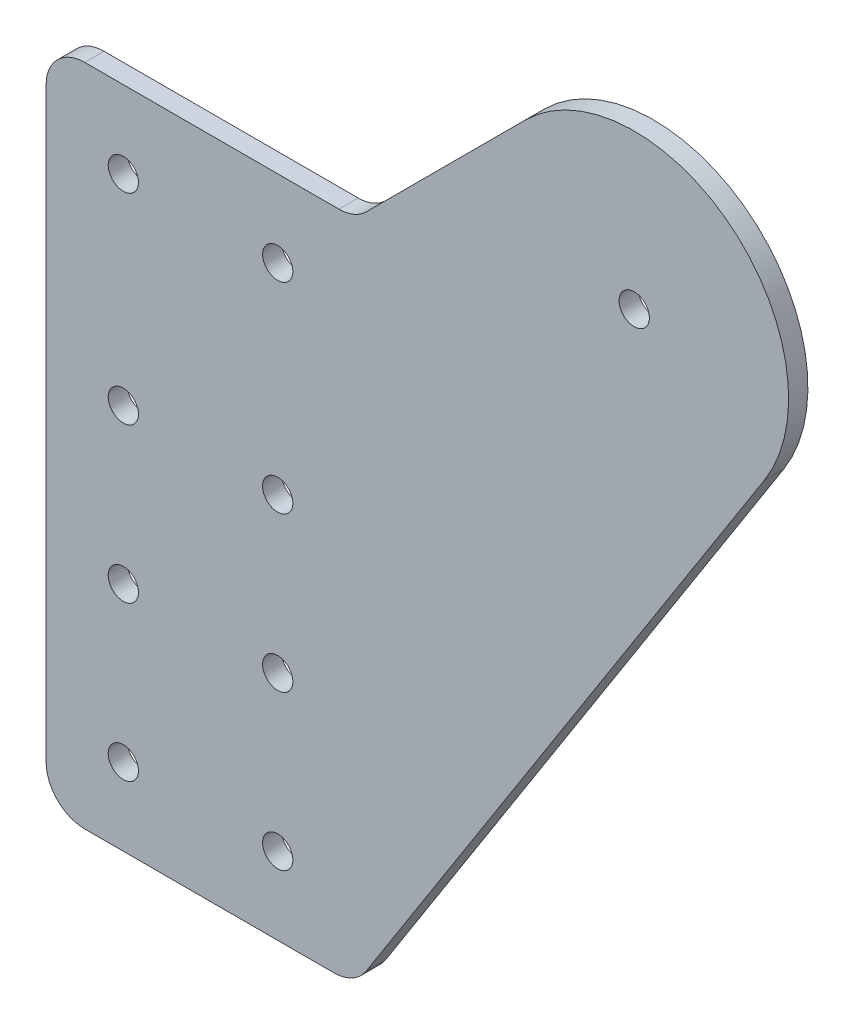
from build123d import *

# Parameters (mm, degrees)
SKETCH2_R           = 2.4892
BOSS_EXTRUDE1_DEPTH = 3.175
SKETCH3_R           = 2.4892
CUT_EXTRUDE1_DEPTH  = 190.356866458
FILLET1_R           = 6.35


with BuildPart() as part:
    # Sketch2 → Boss-Extrude1 (new body)
    with BuildSketch(Plane.XY):
        with BuildLine():
            Line((50.8, 109.22), (78.793223912, 137.213223912))
            ThreePointArc((78.793223912, 137.213223912), (112.658719111, 139.05653749), (118.166879838, 105.591186222))
            Line((118.166879838, 105.591186222), (50.8, 0))
            Line((50.8, 0), (0, 0))
            Line((0, 0), (0, 109.22))
            Line((0, 109.22), (50.8, 109.22))
        make_face()
        with Locations((96.753736154, 119.252711669)):
            Circle(SKETCH2_R, mode=Mode.SUBTRACT)
    extrude(amount=-BOSS_EXTRUDE1_DEPTH)

    # Sketch3 → Cut-Extrude1 (cut, through all)
    with BuildSketch(Plane.XY):
        with Locations((12.7, 96.52)):
            Circle(SKETCH3_R)
        with Locations((38.1, 96.52)):
            Circle(SKETCH3_R)
        with Locations((12.7, 63.5)):
            Circle(SKETCH3_R)
        with Locations((12.7, 38.1)):
            Circle(SKETCH3_R)
        with Locations((12.7, 12.7)):
            Circle(SKETCH3_R)
        with Locations((12.7, -12.7)):
            Circle(SKETCH3_R)
        with Locations((12.7, -38.1)):
            Circle(SKETCH3_R)
        with Locations((38.1, 38.1)):
            Circle(SKETCH3_R)
        with Locations((38.1, 12.7)):
            Circle(SKETCH3_R)
        with Locations((38.1, -12.7)):
            Circle(SKETCH3_R)
        with Locations((38.1, -38.1)):
            Circle(SKETCH3_R)
        with Locations((38.1, 63.5)):
            Circle(SKETCH3_R)
    extrude(amount=-CUT_EXTRUDE1_DEPTH, mode=Mode.SUBTRACT)

    # Fillet1
    fillet1_edges = [part.edges().sort_by_distance(p)[0] for p in [
        (0, 0, -1.5875),
        (50.8, 0, -1.5875),
        (50.8, 109.22, -1.5875),
        (0, 109.22, -1.5875),
    ]]
    fillet(fillet1_edges, radius=FILLET1_R)


solid = part.part
